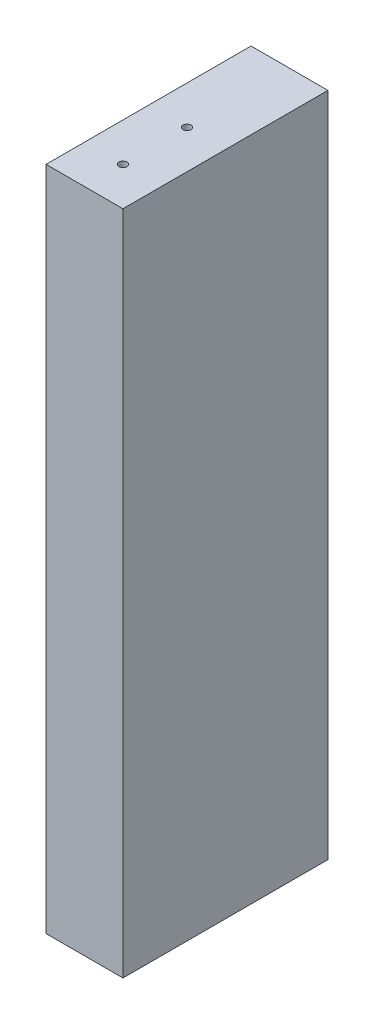
from build123d import *

# Parameters (mm, degrees)
SKETCH1_W                           = 19.05
SKETCH1_H                           = 165.099999729
BOSS_EXTRUDE1_DEPTH                 = 50.8
F_5_64_0_07813_DIAMETER_HOLE1_D     = 1.984502
F_5_64_0_07813_DIAMETER_HOLE1_DEPTH = 38.1
F_5_64_0_07813_DIAMETER_HOLE1_TIP   = 0.59620455
F_5_64_0_07813_DIAMETER_HOLE2_D     = 1.984502
F_5_64_0_07813_DIAMETER_HOLE2_DEPTH = 19.05
F_5_64_0_07813_DIAMETER_HOLE2_TIP   = 0.59620455
F_5_64_0_07813_DIAMETER_HOLE3_D     = 1.984502
F_5_64_0_07813_DIAMETER_HOLE3_DEPTH = 19.05
F_5_64_0_07813_DIAMETER_HOLE3_TIP   = 0.59620455


with BuildPart() as part:
    # Sketch1 → Boss-Extrude1 (new body)
    with BuildSketch(Plane.XY):
        with Locations((440.567640906, 6183.630000136)):
            Rectangle(SKETCH1_W, SKETCH1_H)
    extrude(amount=BOSS_EXTRUDE1_DEPTH)

    # 5/64 (0.07813) Diameter Hole1
    with Locations(Plane(origin=(4.968994719, 3.22e-07, -19.050107671), x_dir=(-1, 0, 0), z_dir=(0, 1.37705190708017e-10, -1.0))):
        with Locations((-481.589248274, 6993.254992531), (-386.339248274, 6993.254992531), (-291.089248274, 6993.254992531), (-295.274999999, 6965.135938474), (-295.274999999, 6812.735938474), (-295.274999999, 6660.335938474), (-285.166362357, 6631.468843414), (-475.477307398, 6631.468752771), (-485.002307398, 6660.335938474), (-485.002307398, 6812.735938474), (-485.002307398, 6965.135938474), (-478.365617646, 6611.6708), (-287.865617646, 6611.6708), (-307.975, 6564.3379), (-307.975, 6488.1379), (-284.960913066, 6440.805), (-380.210913066, 6440.805), (-475.460913066, 6440.805), (-446.831312422, 6488.1379), (-446.831312422, 6564.3379), (-472.231312422, 6396.355), (-472.231312422, 6320.155), (-472.653156211, 6275.705000839), (-377.403156211, 6275.705000839), (-282.153156211, 6275.705000839), (-282.575, 6320.155), (-282.575, 6396.355), (-435.598646187, 6221.729999816), (-435.598646187, 6145.529999816), (-450.592518112, 6091.554999951), (-460.998646187, 6091.555478285), (-460.998646187, 6056.629999944), (-460.998646187, 5980.429999944), (-460.998646187, 5945.505000042), (-282.153156211, 5945.505000042), (-368.611823093, 5945.505000042)):
            Hole(F_5_64_0_07813_DIAMETER_HOLE1_D / 2, depth=F_5_64_0_07813_DIAMETER_HOLE1_DEPTH)
            with Locations((0, 0, -(F_5_64_0_07813_DIAMETER_HOLE1_DEPTH + F_5_64_0_07813_DIAMETER_HOLE1_TIP / 2))):  # 118° drill point
                Cone(0, F_5_64_0_07813_DIAMETER_HOLE1_D / 2, F_5_64_0_07813_DIAMETER_HOLE1_TIP, mode=Mode.SUBTRACT)

    # 5/64 (0.07813) Diameter Hole2
    with Locations(Plane(origin=(0, 6101.080000271, 0), x_dir=(-1, 0, 0), z_dir=(0, -1, 0))):
        with Locations((-440.567640906, -41.274956045), (-440.567640906, -25.399956045)):
            Hole(F_5_64_0_07813_DIAMETER_HOLE2_D / 2, depth=F_5_64_0_07813_DIAMETER_HOLE2_DEPTH)
            with Locations((0, 0, -(F_5_64_0_07813_DIAMETER_HOLE2_DEPTH + F_5_64_0_07813_DIAMETER_HOLE2_TIP / 2))):  # 118° drill point
                Cone(0, F_5_64_0_07813_DIAMETER_HOLE2_D / 2, F_5_64_0_07813_DIAMETER_HOLE2_TIP, mode=Mode.SUBTRACT)

    # 5/64 (0.07813) Diameter Hole3
    with Locations(Plane(origin=(0, 6266.18, 0), x_dir=(1, 0, 0), z_dir=(0, 1, 0))):
        with Locations((440.567640906, -25.399956045), (440.567640906, -41.274956045)):
            Hole(F_5_64_0_07813_DIAMETER_HOLE3_D / 2, depth=F_5_64_0_07813_DIAMETER_HOLE3_DEPTH)
            with Locations((0, 0, -(F_5_64_0_07813_DIAMETER_HOLE3_DEPTH + F_5_64_0_07813_DIAMETER_HOLE3_TIP / 2))):  # 118° drill point
                Cone(0, F_5_64_0_07813_DIAMETER_HOLE3_D / 2, F_5_64_0_07813_DIAMETER_HOLE3_TIP, mode=Mode.SUBTRACT)


solid = part.part
